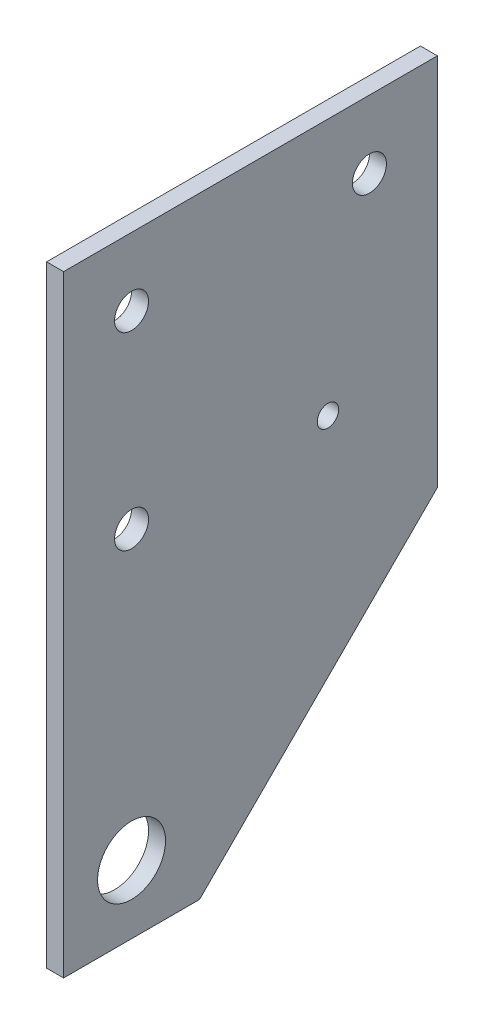
from build123d import *

# Parameters (mm, degrees)
SKETCH1_R           = 2
SKETCH1_R_2         = 6.35
SKETCH1_R_3         = 3.175
BOSS_EXTRUDE1_DEPTH = 3.175


with BuildPart() as part:
    # Sketch1 → Boss-Extrude1 (new body)
    with BuildSketch(Plane(origin=(0, 0, 0), x_dir=(0, 0, -1), z_dir=(1, 0, 0))):
        Polygon((-12.7, 101.6), (57.15, 101.6), (57.15, 31.75), (12.7, -12.7), (-12.7, -12.7), align=None)
        with Locations((36.695774969, 53.601042741)):
            Circle(SKETCH1_R, mode=Mode.SUBTRACT)
        Circle(SKETCH1_R_2, mode=Mode.SUBTRACT)
        with Locations((0, 88.9)):
            Circle(SKETCH1_R_3, mode=Mode.SUBTRACT)
        with Locations((44.45, 88.9)):
            Circle(SKETCH1_R_3, mode=Mode.SUBTRACT)
        with Locations((0, 53.601042741)):
            Circle(SKETCH1_R_3, mode=Mode.SUBTRACT)
    extrude(amount=BOSS_EXTRUDE1_DEPTH)


solid = part.part
